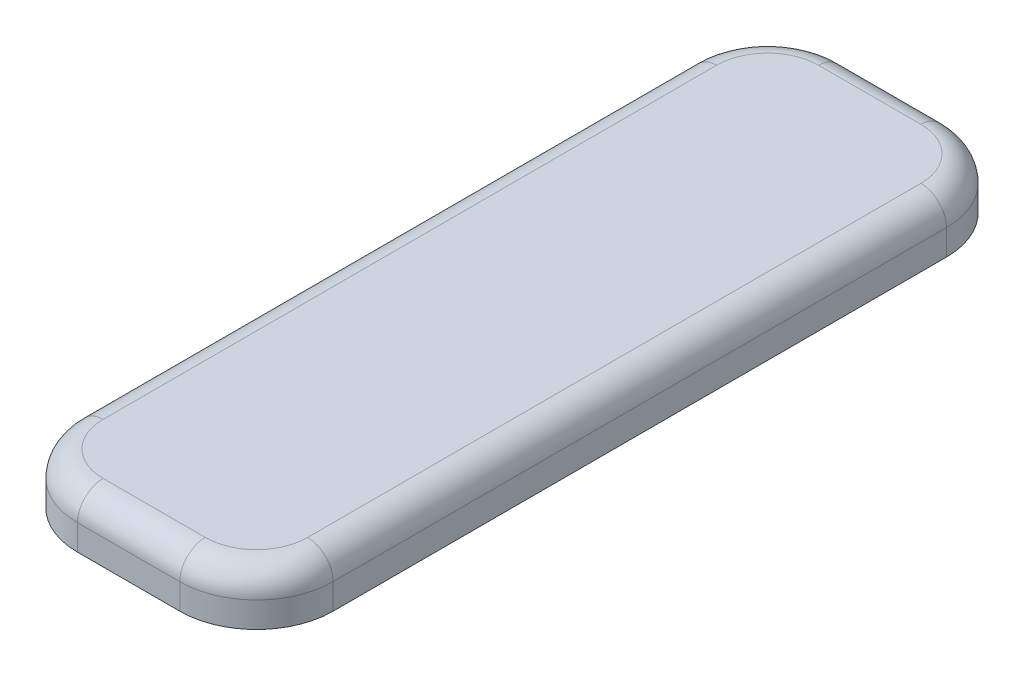
from build123d import *

# Parameters (mm, degrees)
BOSS_EXTRUDE1_DEPTH = 20
FILLET1_R           = 10


with BuildPart() as part:
    # Sketch1 → Boss-Extrude1 (new body)
    with BuildSketch(Plane(origin=(0, 0, 0), x_dir=(1, 0, 0), z_dir=(0, 1, 0))):
        with BuildLine():
            Line((-20, -150), (20, -150))
            ThreePointArc((20, -150), (41.213203436, -141.213203436), (50, -120))
            Line((50, -120), (50, 120))
            ThreePointArc((50, 120), (41.213203436, 141.213203436), (20, 150))
            Line((20, 150), (-20, 150))
            ThreePointArc((-20, 150), (-41.213203436, 141.213203436), (-50, 120))
            Line((-50, 120), (-50, -120))
            ThreePointArc((-50, -120), (-41.213203436, -141.213203436), (-20, -150))
        make_face()
    extrude(amount=BOSS_EXTRUDE1_DEPTH)

    # Fillet1
    fillet1_edges = [part.edges().sort_by_distance(p)[0] for p in [
        (0, 20, -150),
        (41.213203436, 20, -141.213203436),
        (50, 20, 0),
        (41.213203436, 20, 141.213203436),
        (0, 20, 150),
        (-41.213203436, 20, 141.213203436),
        (-50, 20, 0),
        (-41.213203436, 20, -141.213203436),
    ]]
    fillet(fillet1_edges, radius=FILLET1_R)


solid = part.part
